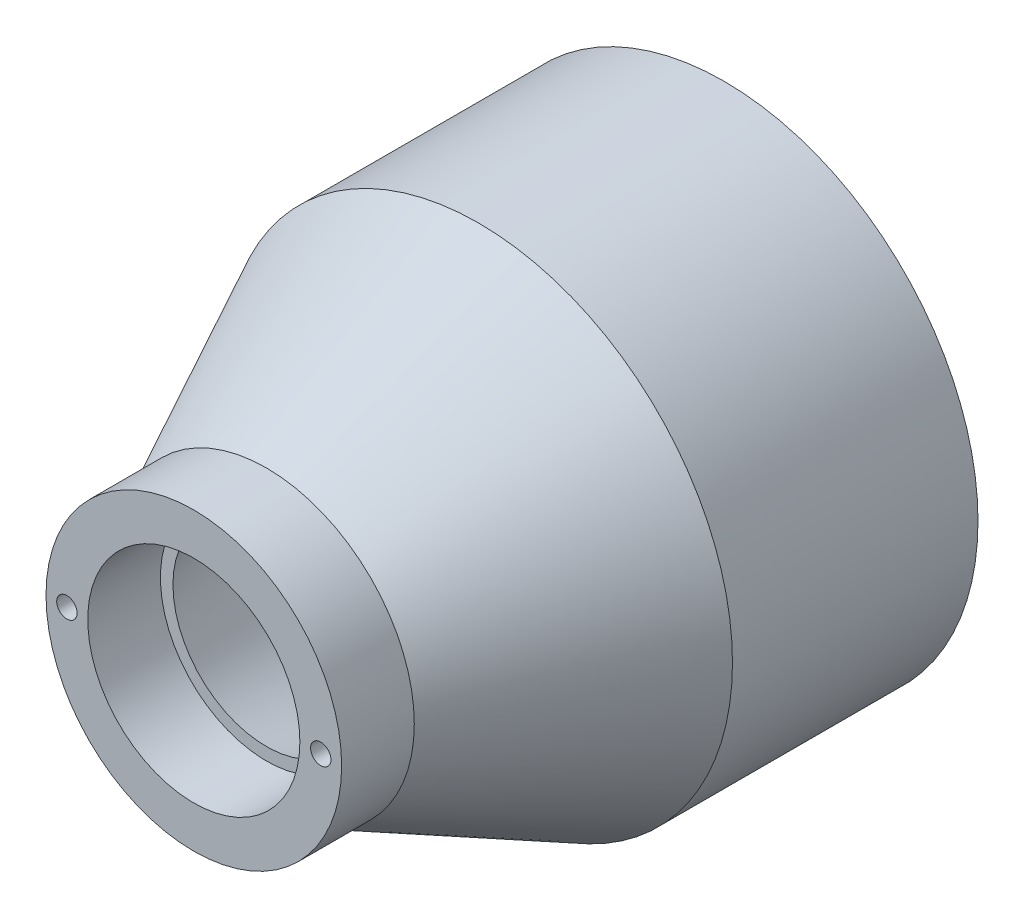
from build123d import *

# Parameters (mm, degrees)
ESQUISSE1_R                     = 17.7
ESQUISSE1_R_2                   = 12.7
BOSS_EXTRU_1_DEPTH              = 8.7
ESQUISSE2_R                     = 30.4
ESQUISSE2_R_2                   = 11.2
BOSS_EXTRU_2_DEPTH              = 49.8
CHANFREIN1_SIZE                 = 25.4
CHANFREIN1_SIZE2                = 12.699971641
CHANFREIN3_SIZE                 = 11.200084029
CHANFREIN3_SIZE_2               = 49.8
F_41_0_096_DIAMETER_HOLE1_D     = 2.4384
F_41_0_096_DIAMETER_HOLE1_DEPTH = 5
F_41_0_096_DIAMETER_HOLE1_TIP   = 0.732569267
SKETCH5_R                       = 30.4
SKETCH5_R_2                     = 25.4
BOSS_EXTRUDE1_DEPTH             = 5


# Read off the part's stored shape, not the designer's step: AdvancedHole1
with BuildPart() as part:
    # Esquisse1 → Boss.-Extru.1 (new body)
    with BuildSketch(Plane.XY):
        Circle(ESQUISSE1_R)
        Circle(ESQUISSE1_R_2, mode=Mode.SUBTRACT)
    extrude(amount=BOSS_EXTRU_1_DEPTH)

    # Esquisse2 → Boss.-Extru.2 (add)
    with BuildSketch(Plane(origin=(0, 0, 0), x_dir=(-1, 0, 0), z_dir=(0, 0, -1))):
        Circle(ESQUISSE2_R)
        Circle(ESQUISSE2_R_2, mode=Mode.SUBTRACT)
    extrude(amount=BOSS_EXTRU_2_DEPTH)

    # Chanfrein1
    chanfrein1_edges = [part.edges().sort_by_distance(p)[0] for p in [
        (30.4, 0, 0),
    ]]
    chanfrein1_side = [part.faces().sort_by_distance(p)[0] for p in [
        (30.4, 0, -24.9),
    ]]
    chamfer(chanfrein1_edges, length=CHANFREIN1_SIZE, length2=CHANFREIN1_SIZE2, reference=chanfrein1_side[0])

    # Chanfrein3
    # the kernel refuses this chamfer: 49.8, 11.200084029 mm, written as the material it takes off along each edge
    with BuildSketch(Plane(origin=(0, 0, -49.8), x_dir=(-1, 0, 0), z_dir=(0, -1, 0))) as chanfrein3_piece_1:
        Polygon((11.2 + CHANFREIN3_SIZE, 0), (11.2, -CHANFREIN3_SIZE_2), (11.2, 0), align=None)
    revolve(axis=Axis((0, 0, -49.8), (0, 0, -1)), mode=Mode.SUBTRACT)

    # #41 (0.096) Diameter Hole1
    with Locations(Plane.XY.offset(8.7)):
        with Locations((-15.2, 0), (15.2, 0)):
            Hole(F_41_0_096_DIAMETER_HOLE1_D / 2, depth=F_41_0_096_DIAMETER_HOLE1_DEPTH)
            with Locations((0, 0, -(F_41_0_096_DIAMETER_HOLE1_DEPTH + F_41_0_096_DIAMETER_HOLE1_TIP / 2))):  # 118° drill point
                Cone(0, F_41_0_096_DIAMETER_HOLE1_D / 2, F_41_0_096_DIAMETER_HOLE1_TIP, mode=Mode.SUBTRACT)

    # Sketch5 → Boss-Extrude1 (add)
    with BuildSketch(Plane(origin=(0, 0, -49.8), x_dir=(-1, 0, 0), z_dir=(0, 0, -1))):
        Circle(SKETCH5_R)
        Circle(SKETCH5_R_2, mode=Mode.SUBTRACT)
    extrude(amount=BOSS_EXTRUDE1_DEPTH)

    # AdvancedHole1 outline → AdvancedHole1 (revolve, cut)
    with BuildSketch(Plane.XZ.offset(-27.9)):
        Polygon((1.2192, -54.8), (1.2192, -49.72), (0, -48.987430733), (0, -54.8), align=None)
    advancedhole1 = revolve(axis=Axis((0, 27.9, 0), (0, 0, 1)), mode=Mode.SUBTRACT)

    # Mirror1: AdvancedHole1 across plane
    add(advancedhole1.mirror(Plane.ZX), mode=Mode.SUBTRACT)


solid = part.part
